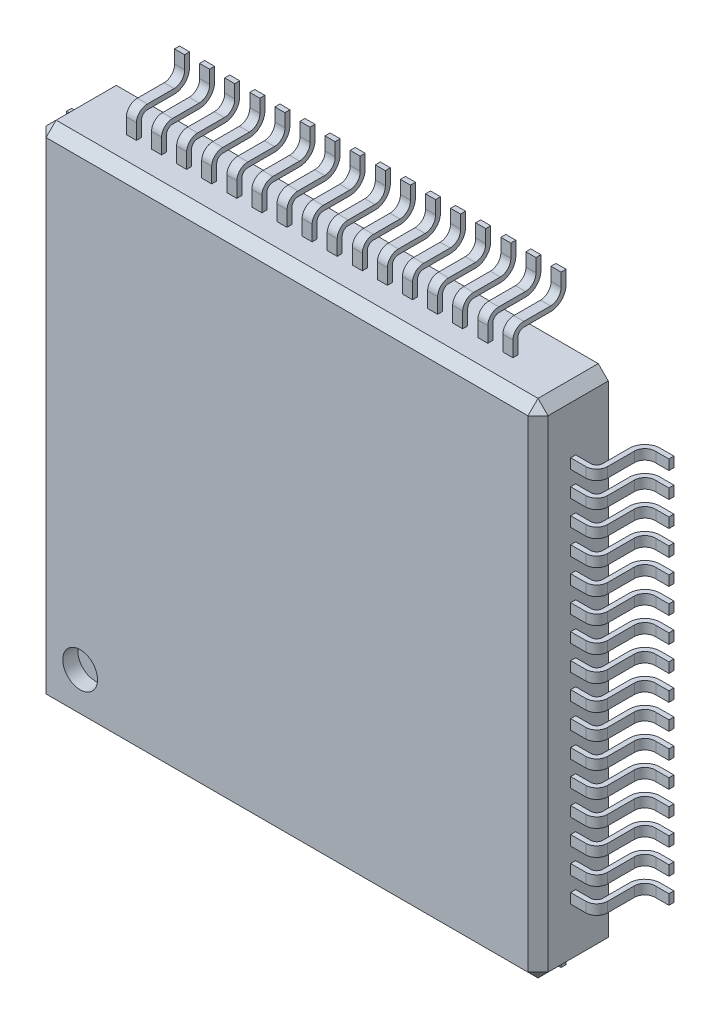
from build123d import *

# Parameters (mm, degrees)
SKETCH1_W               = 10
SKETCH1_H               = 10
EXTRUDE1_DEPTH          = 1.4
SKETCH2_W               = 0.2
SKETCH2_H               = 0.1
MIRROR2_COPY_1_SKETCH_W = 0.2
MIRROR2_COPY_1_SKETCH_H = 0.1
CHAMFER1_SIZE           = 0.2
SKETCH_1_R              = 0.345974717
CUT_EXTRUDE_1_DEPTH     = 0.3


with BuildPart() as part:
    # Sketch1 → Extrude1 (new body)
    with BuildSketch(Plane.XY):
        with Locations((5, 5)):
            Rectangle(SKETCH1_W, SKETCH1_H)
    extrude(amount=EXTRUDE1_DEPTH)

    # Sweep1: sweep along a path in Sketch3
    with BuildLine(Plane(origin=(10, 0, 0), x_dir=(0, 0, -1), z_dir=(1, 0, 0))) as sweep1_path:
        Line((-0.7, 0), (-0.7, -0.304241195))
        ThreePointArc((-0.7, -0.304241195), (-0.649074689, -0.421392539), (-0.530776334, -0.469593409))
        Line((-0.530776334, -0.469593409), (0, -0.469593409))
        ThreePointArc((0, -0.469593409), (0.187691377, -0.550311576), (0.25820146, -0.74207133))
        Line((0.25820146, -0.74207133), (0.25820146, -1))
    # Sketch2 → Sweep1 (sweep)
    with BuildSketch(Plane.XZ):
        with Locations((5.25, 0.7)):
            Rectangle(SKETCH2_W, SKETCH2_H)
        with Locations((1.25, 0.7)):
            Rectangle(SKETCH2_W, SKETCH2_H)
        with Locations((1.75, 0.7)):
            Rectangle(SKETCH2_W, SKETCH2_H)
        with Locations((2.25, 0.7)):
            Rectangle(SKETCH2_W, SKETCH2_H)
        with Locations((2.75, 0.7)):
            Rectangle(SKETCH2_W, SKETCH2_H)
        with Locations((3.25, 0.7)):
            Rectangle(SKETCH2_W, SKETCH2_H)
        with Locations((3.75, 0.7)):
            Rectangle(SKETCH2_W, SKETCH2_H)
        with Locations((4.25, 0.7)):
            Rectangle(SKETCH2_W, SKETCH2_H)
        with Locations((4.75, 0.7)):
            Rectangle(SKETCH2_W, SKETCH2_H)
        with Locations((5.75, 0.7)):
            Rectangle(SKETCH2_W, SKETCH2_H)
        with Locations((6.25, 0.7)):
            Rectangle(SKETCH2_W, SKETCH2_H)
        with Locations((6.75, 0.7)):
            Rectangle(SKETCH2_W, SKETCH2_H)
        with Locations((7.25, 0.7)):
            Rectangle(SKETCH2_W, SKETCH2_H)
        with Locations((7.75, 0.7)):
            Rectangle(SKETCH2_W, SKETCH2_H)
        with Locations((8.25, 0.7)):
            Rectangle(SKETCH2_W, SKETCH2_H)
        with Locations((8.75, 0.7)):
            Rectangle(SKETCH2_W, SKETCH2_H)
    sweep1 = sweep(path=sweep1_path.line, transition=Transition.RIGHT)

    # Mirror1: Sweep1 across plane
    add(sweep1.mirror(Plane(origin=(0, 0, 0), x_dir=(0, 0, 1), z_dir=(-0.7071067811865477, 0.7071067811865474, 0))))

    # Mirror2: Sweep1 across plane
    add(sweep1.mirror(Plane(origin=(5, 5, 0), x_dir=(0, 0, 1), z_dir=(-0.7071067811865477, -0.7071067811865474, 0))))

    # Mirror2 copy 1: sweep along a path in Mirror2 copy 1 path
    with BuildLine(Plane(origin=(0, 10, 0), x_dir=(0, 0, -1), z_dir=(-1, 0, 0))) as mirror2_copy_1_path:
        Line((-0.7, 0), (-0.7, -0.304241195))
        ThreePointArc((-0.7, -0.304241195), (-0.649074689, -0.421392539), (-0.530776334, -0.469593409))
        Line((-0.530776334, -0.469593409), (0, -0.469593409))
        ThreePointArc((0, -0.469593409), (0.187691377, -0.550311576), (0.25820146, -0.74207133))
        Line((0.25820146, -0.74207133), (0.25820146, -1))
    # Mirror2 copy 1 sketch → Mirror2 copy 1 (sweep)
    with BuildSketch(Plane(origin=(10, 10, 0), x_dir=(-1, 0, 0), z_dir=(0, 1, 0))):
        with Locations((5.25, 0.7)):
            Rectangle(MIRROR2_COPY_1_SKETCH_W, MIRROR2_COPY_1_SKETCH_H)
        with Locations((1.25, 0.7)):
            Rectangle(MIRROR2_COPY_1_SKETCH_W, MIRROR2_COPY_1_SKETCH_H)
        with Locations((1.75, 0.7)):
            Rectangle(MIRROR2_COPY_1_SKETCH_W, MIRROR2_COPY_1_SKETCH_H)
        with Locations((2.25, 0.7)):
            Rectangle(MIRROR2_COPY_1_SKETCH_W, MIRROR2_COPY_1_SKETCH_H)
        with Locations((2.75, 0.7)):
            Rectangle(MIRROR2_COPY_1_SKETCH_W, MIRROR2_COPY_1_SKETCH_H)
        with Locations((3.25, 0.7)):
            Rectangle(MIRROR2_COPY_1_SKETCH_W, MIRROR2_COPY_1_SKETCH_H)
        with Locations((3.75, 0.7)):
            Rectangle(MIRROR2_COPY_1_SKETCH_W, MIRROR2_COPY_1_SKETCH_H)
        with Locations((4.25, 0.7)):
            Rectangle(MIRROR2_COPY_1_SKETCH_W, MIRROR2_COPY_1_SKETCH_H)
        with Locations((4.75, 0.7)):
            Rectangle(MIRROR2_COPY_1_SKETCH_W, MIRROR2_COPY_1_SKETCH_H)
        with Locations((5.75, 0.7)):
            Rectangle(MIRROR2_COPY_1_SKETCH_W, MIRROR2_COPY_1_SKETCH_H)
        with Locations((6.25, 0.7)):
            Rectangle(MIRROR2_COPY_1_SKETCH_W, MIRROR2_COPY_1_SKETCH_H)
        with Locations((6.75, 0.7)):
            Rectangle(MIRROR2_COPY_1_SKETCH_W, MIRROR2_COPY_1_SKETCH_H)
        with Locations((7.25, 0.7)):
            Rectangle(MIRROR2_COPY_1_SKETCH_W, MIRROR2_COPY_1_SKETCH_H)
        with Locations((7.75, 0.7)):
            Rectangle(MIRROR2_COPY_1_SKETCH_W, MIRROR2_COPY_1_SKETCH_H)
        with Locations((8.25, 0.7)):
            Rectangle(MIRROR2_COPY_1_SKETCH_W, MIRROR2_COPY_1_SKETCH_H)
        with Locations((8.75, 0.7)):
            Rectangle(MIRROR2_COPY_1_SKETCH_W, MIRROR2_COPY_1_SKETCH_H)
    sweep(path=mirror2_copy_1_path.line, transition=Transition.RIGHT)

    # Chamfer1
    chamfer1_edges = [part.edges().sort_by_distance(p)[0] for p in [
        (0, 0, 0.7),
        (5, 0, 1.4),
        (0, 5, 1.4),
        (0, 10, 0.7),
        (10, 0, 0.7),
        (10, 10, 0.7),
        (5, 10, 1.4),
        (10, 5, 1.4),
    ]]
    chamfer(chamfer1_edges, length=CHAMFER1_SIZE)

    # Эскиз1 → Вырез-Вытянуть1 (cut)
    with BuildSketch(Plane.XY.offset(1.4)):
        with Locations((0.878908849, 0.958749168)):
            Circle(SKETCH_1_R)
    extrude(amount=-CUT_EXTRUDE_1_DEPTH, mode=Mode.SUBTRACT)


solid = part.part
